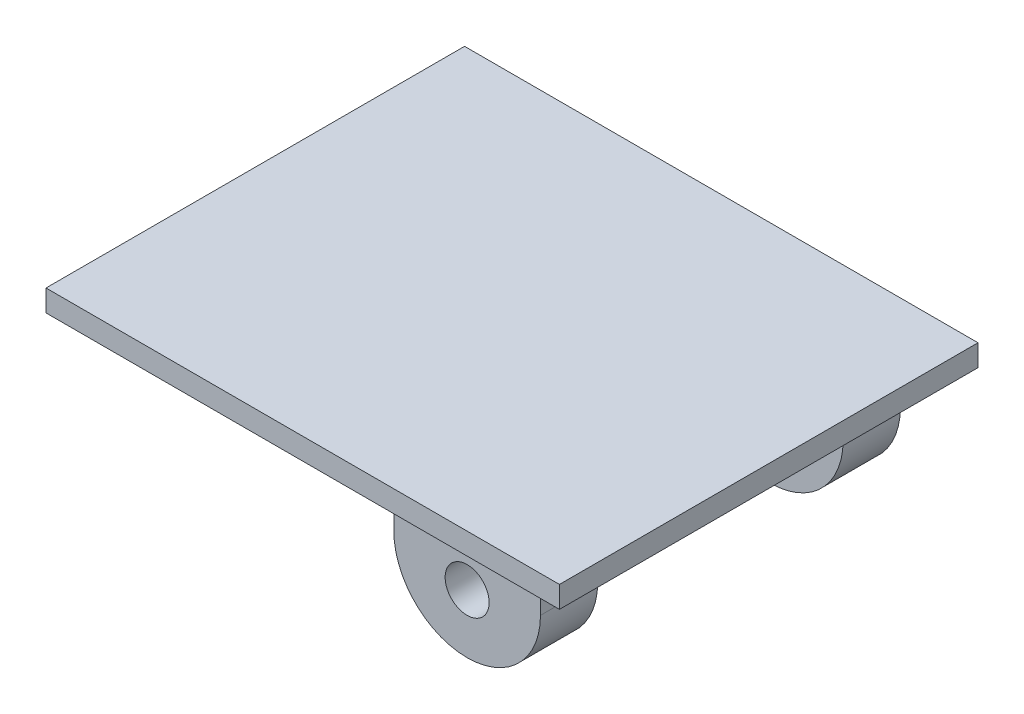
from build123d import *

# Parameters (mm, degrees)
BOSS_EXTRUDE1_DEPTH      = 2000
BOSS_EXTRUDE1_DEPTH_BACK = 1500
SKETCH2_W                = 2853.312792679
SKETCH2_H                = 147.296707974
SKETCH3_R                = 150
BOSS_EXTRUDE2_DEPTH      = 390
BOSS_EXTRUDE3_START      = -390
SKETCH5_R                = 150
BOSS_EXTRUDE3_DEPTH      = 390


with BuildPart() as part:
    # Sketch2 → Boss-Extrude1 (new, two sides: drawn at the far end of the back side and taken through both)
    with BuildSketch(Plane(origin=(0, 0, 0), x_dir=(0, 0, -1), z_dir=(1, 0, 0)).offset(-BOSS_EXTRUDE1_DEPTH_BACK)):
        with Locations((-1258.550829655, -1266.618656137)):
            Rectangle(SKETCH2_W, SKETCH2_H)
    extrude(amount=BOSS_EXTRUDE1_DEPTH + BOSS_EXTRUDE1_DEPTH_BACK)

    # Sketch3 → Boss-Extrude2 (add)
    with BuildSketch(Plane(origin=(0, 0, 31.894433316), x_dir=(-1, 0, 0), z_dir=(0, 0, -1))):
        with BuildLine():
            Line((-670.760339717, -1340.267010124), (-1670.760339717, -1340.267010124))
            Line((-1670.760339717, -1340.267010124), (-1670.760339717, -1640.267010124))
            ThreePointArc((-1670.760339717, -1640.267010124), (-1170.760339717, -2140.267010124), (-670.760339717, -1640.267010124))
            Line((-670.760339717, -1640.267010124), (-670.760339717, -1340.267010124))
        make_face()
        with Locations((-1170.760339717, -1740.267010124)):
            Circle(SKETCH3_R, mode=Mode.SUBTRACT)
    extrude(amount=-BOSS_EXTRUDE2_DEPTH)

    # Sketch5 → Boss-Extrude3 (add)
    with BuildSketch(Plane.XY.offset(2485.207225995).offset(BOSS_EXTRUDE3_START)):
        with BuildLine():
            Line((1670.760339717, -1340.267010124), (670.760339717, -1340.267010124))
            Line((670.760339717, -1340.267010124), (670.760339717, -1640.267010124))
            ThreePointArc((670.760339717, -1640.267010124), (1170.760339717, -2140.267010124), (1670.760339717, -1640.267010124))
            Line((1670.760339717, -1640.267010124), (1670.760339717, -1340.267010124))
        make_face()
        with Locations((1170.760339717, -1740.267010124)):
            Circle(SKETCH5_R, mode=Mode.SUBTRACT)
    extrude(amount=BOSS_EXTRUDE3_DEPTH)


solid = part.part
